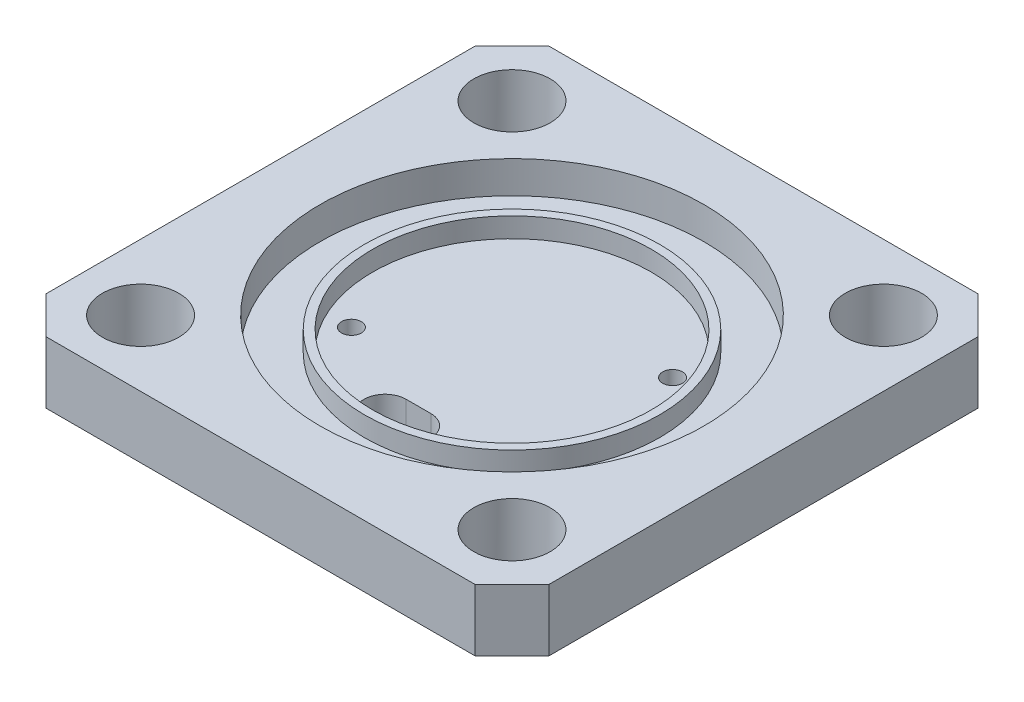
from build123d import *

# Parameters (mm, degrees)
SKETCH1_W           = 40.64
SKETCH1_H           = 40.64
BOSS_EXTRUDE1_DEPTH = 5
CUT_EXTRUDE1_REACH  = 31.169
SKETCH2_R           = 3.085
CHAMFER1_SIZE       = 3
SKETCH3_R           = 11.25
CUT_EXTRUDE2_DEPTH  = 2.6
SKETCH4_R           = 15.5
SKETCH4_R_2         = 11.925
CUT_EXTRUDE3_DEPTH  = 2.6
CUT_EXTRUDE4_DEPTH  = 29.854199001
SKETCH6_R           = 11.925
SKETCH6_R_2         = 11.25
CUT_EXTRUDE5_DEPTH  = 1
SKETCH7_R           = 0.8
CUT_EXTRUDE6_DEPTH  = 29.854199001


with BuildPart() as part:
    # Sketch1 → Boss-Extrude1 (new body)
    with BuildSketch(Plane(origin=(0, 0, 0), x_dir=(1, 0, 0), z_dir=(0, 1, 0))):
        Rectangle(SKETCH1_W, SKETCH1_H)
    extrude(amount=BOSS_EXTRUDE1_DEPTH)

    # Sketch2 → Cut-Extrude1 (cut, up to next)
    with BuildSketch(Plane(origin=(0, 5, 0), x_dir=(1, 0, 0), z_dir=(0, 1, 0)), mode=Mode.PRIVATE) as cut_extrude1_sk1:
        with Locations((-15, 15)):
            Circle(SKETCH2_R)
    cut_extrude1_tool1 = extrude(cut_extrude1_sk1.sketch, amount=-CUT_EXTRUDE1_REACH, mode=Mode.PRIVATE) & part.part
    # Sketch2 → Cut-Extrude1 (cut, up to next)
    with BuildSketch(Plane(origin=(0, 5, 0), x_dir=(1, 0, 0), z_dir=(0, 1, 0)), mode=Mode.PRIVATE) as cut_extrude1_sk2:
        with Locations((15, 15)):
            Circle(SKETCH2_R)
    cut_extrude1_tool2 = extrude(cut_extrude1_sk2.sketch, amount=-CUT_EXTRUDE1_REACH, mode=Mode.PRIVATE) & part.part
    # Sketch2 → Cut-Extrude1 (cut, up to next)
    with BuildSketch(Plane(origin=(0, 5, 0), x_dir=(1, 0, 0), z_dir=(0, 1, 0)), mode=Mode.PRIVATE) as cut_extrude1_sk3:
        with Locations((15, -15)):
            Circle(SKETCH2_R)
    cut_extrude1_tool3 = extrude(cut_extrude1_sk3.sketch, amount=-CUT_EXTRUDE1_REACH, mode=Mode.PRIVATE) & part.part
    # Sketch2 → Cut-Extrude1 (cut, up to next)
    with BuildSketch(Plane(origin=(0, 5, 0), x_dir=(1, 0, 0), z_dir=(0, 1, 0)), mode=Mode.PRIVATE) as cut_extrude1_sk4:
        with Locations((-15, -15)):
            Circle(SKETCH2_R)
    cut_extrude1_tool4 = extrude(cut_extrude1_sk4.sketch, amount=-CUT_EXTRUDE1_REACH, mode=Mode.PRIVATE) & part.part
    add(cut_extrude1_tool1.solids().sort_by_distance((-15, 5, -15))[0], mode=Mode.SUBTRACT)
    add(cut_extrude1_tool2.solids().sort_by_distance((15, 5, -15))[0], mode=Mode.SUBTRACT)
    add(cut_extrude1_tool3.solids().sort_by_distance((15, 5, 15))[0], mode=Mode.SUBTRACT)
    add(cut_extrude1_tool4.solids().sort_by_distance((-15, 5, 15))[0], mode=Mode.SUBTRACT)

    # Chamfer1
    chamfer1_edges = [part.edges().sort_by_distance(p)[0] for p in [
        (-20.32, 2.5, 20.32),
        (20.32, 2.5, 20.32),
        (20.32, 2.5, -20.32),
        (-20.32, 2.5, -20.32),
    ]]
    chamfer(chamfer1_edges, length=CHAMFER1_SIZE)

    # Sketch3 → Cut-Extrude2 (cut)
    with BuildSketch(Plane(origin=(0, 5, 0), x_dir=(1, 0, 0), z_dir=(0, 1, 0))):
        Circle(SKETCH3_R)
    extrude(amount=-CUT_EXTRUDE2_DEPTH, mode=Mode.SUBTRACT)

    # Sketch4 → Cut-Extrude3 (cut)
    with BuildSketch(Plane(origin=(0, 5, 0), x_dir=(1, 0, 0), z_dir=(0, 1, 0))):
        Circle(SKETCH4_R)
        Circle(SKETCH4_R_2, mode=Mode.SUBTRACT)
    extrude(amount=-CUT_EXTRUDE3_DEPTH, mode=Mode.SUBTRACT)

    # Sketch5 → Cut-Extrude4 (cut, through all)
    with BuildSketch(Plane(origin=(0, 2.4, 0), x_dir=(1, 0, 0), z_dir=(0, 1, 0))):
        with BuildLine():
            Line((-1, -7.55), (1, -7.55))
            ThreePointArc((1, -7.55), (2.7, -9.25), (1, -10.95))
            Line((1, -10.95), (-1, -10.95))
            ThreePointArc((-1, -10.95), (-2.7, -9.25), (-1, -7.55))
        make_face()
    extrude(amount=-CUT_EXTRUDE4_DEPTH, mode=Mode.SUBTRACT)

    # Sketch6 → Cut-Extrude5 (cut)
    with BuildSketch(Plane(origin=(0, 5, 0), x_dir=(1, 0, 0), z_dir=(0, 1, 0))):
        Circle(SKETCH6_R)
        Circle(SKETCH6_R_2, mode=Mode.SUBTRACT)
    extrude(amount=-CUT_EXTRUDE5_DEPTH, mode=Mode.SUBTRACT)

    # Sketch7 → Cut-Extrude6 (cut, through all)
    with BuildSketch(Plane(origin=(0, 2.4, 0), x_dir=(1, 0, 0), z_dir=(0, 1, 0))):
        with Locations((8.243053696, 4.727309167)):
            Circle(SKETCH7_R)
        with Locations((-8.243053696, -4.727309167)):
            Circle(SKETCH7_R)
    extrude(amount=-CUT_EXTRUDE6_DEPTH, mode=Mode.SUBTRACT)


solid = part.part
